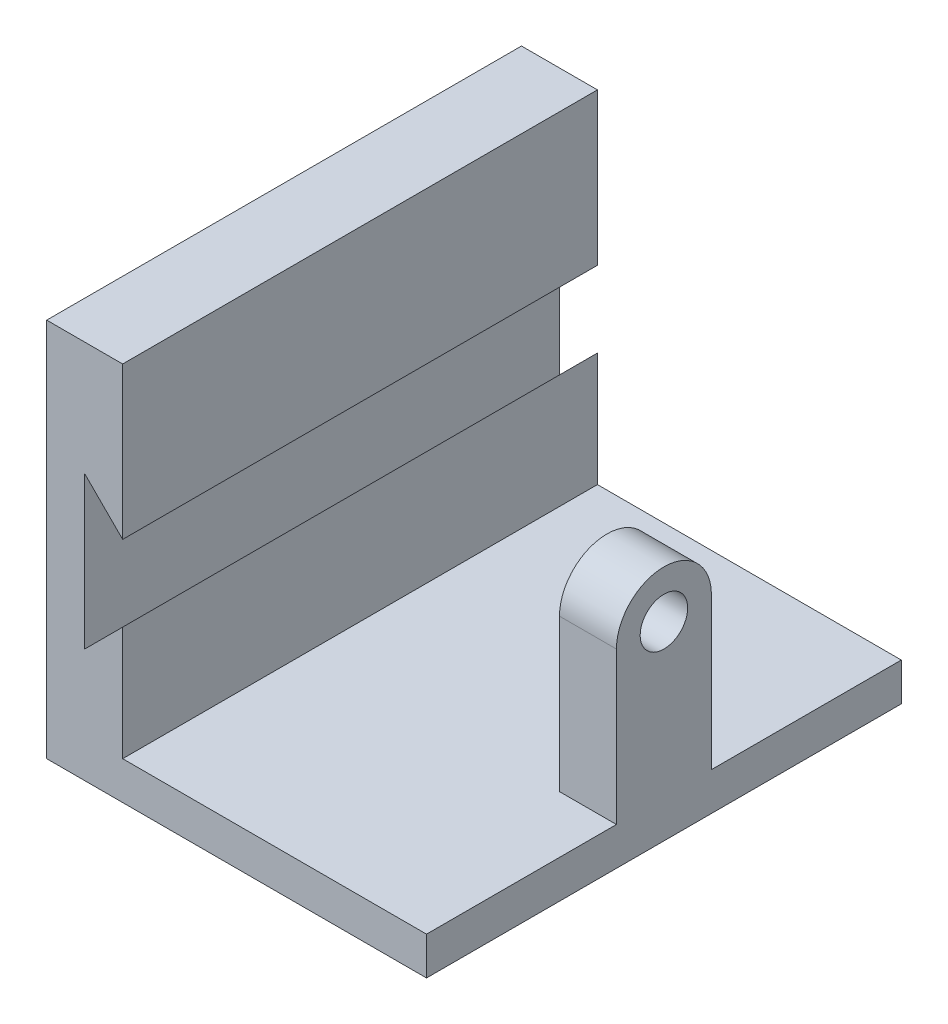
from build123d import *

# Parameters (mm, degrees)
BOSS_EXTRUDE1_DEPTH = 125
SKETCH2_R           = 12.5
BOSS_EXTRUDE2_DEPTH = 30


with BuildPart() as part:
    # Sketch1 → Boss-Extrude1 (new, symmetric)
    with BuildSketch(Plane.XY):
        Polygon((0, 0), (-200, 0), (-200, 200), (-160, 200), (-160, 120), (-180, 140), (-180, 60), (-160, 80), (-160, 20), (0, 20), align=None)
    extrude(amount=BOSS_EXTRUDE1_DEPTH, both=True)

    # Sketch2 → Boss-Extrude2 (add)
    with BuildSketch(Plane(origin=(0, 0, 0), x_dir=(0, 0, -1), z_dir=(1, 0, 0))):
        with BuildLine():
            Line((-25, 100), (-25, 0))
            Line((-25, 0), (0, 0))
            Line((0, 0), (25, 0))
            Line((25, 0), (25, 100))
            ThreePointArc((25, 100), (0, 125), (-25, 100))
        make_face()
        with Locations((0, 100)):
            Circle(SKETCH2_R, mode=Mode.SUBTRACT)
    extrude(amount=-BOSS_EXTRUDE2_DEPTH)


solid = part.part
